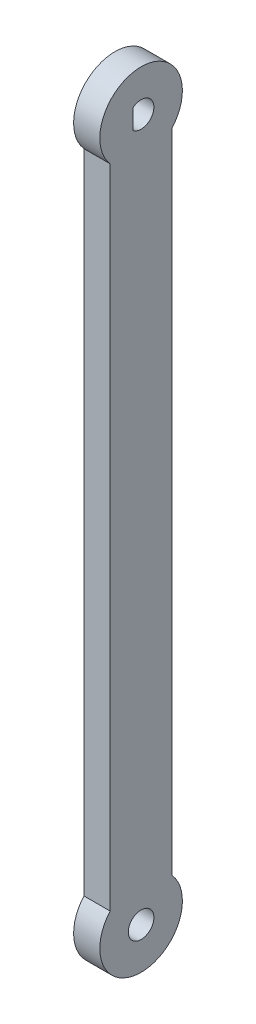
from build123d import *

# Parameters (mm, degrees)
SKETCH1_R           = 1.55
BOSS_EXTRUDE3_DEPTH = 3.175


with BuildPart() as part:
    # Sketch1 → Boss-Extrude3 (new body)
    with BuildSketch(Plane(origin=(0, 0, 0), x_dir=(0, 0, -1), z_dir=(1, 0, 0))):
        with BuildLine():
            Line((3.75, -3.307189139), (3.75, -81.692810861))
            ThreePointArc((3.75, -81.692810861), (0, -90), (-3.75, -81.692810861))
            Line((-3.75, -81.692810861), (-3.75, -3.307189139))
            ThreePointArc((-3.75, -3.307189139), (0, 5), (3.75, -3.307189139))
        make_face()
        with Locations((0, -85)):
            Circle(SKETCH1_R, mode=Mode.SUBTRACT)
        with BuildLine():
            Line((-1, 1.184271928), (-1, -1.184271928))
            ThreePointArc((-1, -1.184271928), (1.55, 0), (-1, 1.184271928))
        make_face(mode=Mode.SUBTRACT)
    extrude(amount=BOSS_EXTRUDE3_DEPTH)


solid = part.part
